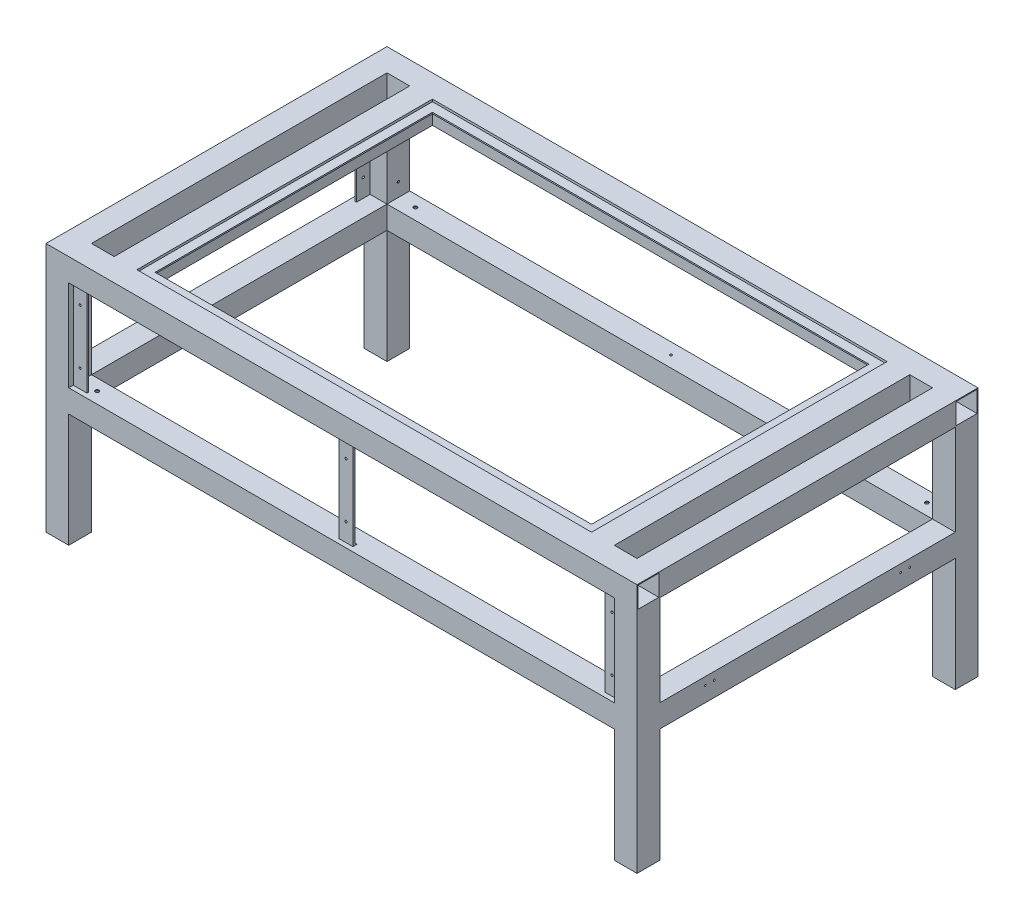
from build123d import *

# Parameters (mm, degrees)
ESQUISSE1_W                = 1300
ESQUISSE1_H                = 750
ESQUISSE1_W_2              = 1200
ESQUISSE1_H_2              = 650
BOSS_EXTRU_1_DEPTH         = 550
ESQUISSE2_W                = 1200
ESQUISSE2_H                = 200
ESQUISSE2_H_2              = 250
ENL_V_MAT_EXTRU_1_DEPTH    = 1599.436736315
ESQUISSE3_W                = 650
ESQUISSE3_H                = 200
ESQUISSE3_H_2              = 250
ENL_V_MAT_EXTRU_2_DEPTH    = 1599.436736315
ESQUISSE4_W                = 50
ESQUISSE4_H                = 650
BOSS_EXTRU_2_DEPTH         = 50
BOSS_EXTRU_2_2_DEPTH       = 50
ESQUISSE18_R               = 4
ENL_V_MAT_EXTRU_5_DEPTH    = 80
ESQUISSE19_R               = 15
ENL_V_MAT_EXTRU_6_DEPTH    = 48
ESQUISSE20_W               = 46
ESQUISSE20_H               = 46
ENL_V_MAT_EXTRU_7_DEPTH    = 10000
ESQUISSE21_W               = 46
ESQUISSE21_H               = 46
ENL_V_MAT_EXTRU_8_DEPTH    = 500
ESQUISSE22_W               = 30
ESQUISSE22_H               = 200
BOSS_EXTRU_11_DEPTH        = 3
ESQUISSE23_W               = 30
ESQUISSE23_H               = 200
ESQUISSE23_R               = 2.5
BOSS_EXTRU_12_DEPTH        = 3
ESQUISSE25_W               = 1000
ESQUISSE25_H               = 20
BOSS_EXTRU_14_DEPTH        = 3
ESQUISSE26_W               = 1000
ESQUISSE26_H               = 20
BOSS_EXTRU_15_DEPTH        = 3
ESQUISSE27_W               = 650
ESQUISSE27_H               = 20
BOSS_EXTRU_16_DEPTH        = 3
ESQUISSE28_W               = 20
ESQUISSE28_H               = 650
BOSS_EXTRU_17_DEPTH        = 3
ESQUISSE29_R               = 2.5
ENL_V_MAT_EXTRU_9_DEPTH    = 10
ESQUISSE30_R               = 2.5
ENL_V_MAT_EXTRU_10_DEPTH   = 15
ESQUISSE31_W               = 30
ESQUISSE31_H               = 5
BOSS_EXTRU_18_DEPTH        = 200
CONG_1_R                   = 5
ESQUISSE32_R               = 2.5
ENL_V_MAT_EXTRU_11_DEPTH   = 5
SYM_TRIE15_COPY_1_SKETCH_W = 30
SYM_TRIE15_COPY_1_SKETCH_H = 200
SYM_TRIE15_COPY_1_DEPTH    = 3
SYM_TRIE15_COPY_2_SKETCH_W = 30
SYM_TRIE15_COPY_2_SKETCH_H = 200
SYM_TRIE15_COPY_2_SKETCH_R = 2.5
SYM_TRIE15_COPY_2_DEPTH    = 3
SYM_TRIE15_COPY_3_SKETCH_W = 30
SYM_TRIE15_COPY_3_SKETCH_H = 200
SYM_TRIE15_COPY_3_DEPTH    = 3
SYM_TRIE15_COPY_4_SKETCH_W = 30
SYM_TRIE15_COPY_4_SKETCH_H = 200
SYM_TRIE15_COPY_4_SKETCH_R = 2.5
SYM_TRIE15_COPY_4_DEPTH    = 3
ESQUISSE33_W               = 80.648964208
ESQUISSE33_H               = 200
ENL_V_MAT_EXTRU_12_DEPTH   = 78
ESQUISSE34_R               = 2
ENL_V_MAT_EXTRU_13_DEPTH   = 25


with BuildPart() as part:
    # Esquisse1 → Boss.-Extru.1 (new body)
    with BuildSketch(Plane(origin=(0, 0, 0), x_dir=(1, 0, 0), z_dir=(0, 1, 0))):
        with Locations((650, 375)):
            Rectangle(ESQUISSE1_W, ESQUISSE1_H)
        with Locations((650, 375)):
            Rectangle(ESQUISSE1_W_2, ESQUISSE1_H_2, mode=Mode.SUBTRACT)
    extrude(amount=-BOSS_EXTRU_1_DEPTH)

    # Esquisse2 → Enlèv. mat.-Extru.1 (cut, through all)
    with BuildSketch(Plane.XY):
        with Locations((650, -150)):
            Rectangle(ESQUISSE2_W, ESQUISSE2_H)
        with Locations((650, -425)):
            Rectangle(ESQUISSE2_W, ESQUISSE2_H_2)
    extrude(amount=-ENL_V_MAT_EXTRU_1_DEPTH, mode=Mode.SUBTRACT)

    # Esquisse3 → Enlèv. mat.-Extru.2 (cut, through all)
    with BuildSketch(Plane.ZY):
        with Locations((-375, -150)):
            Rectangle(ESQUISSE3_W, ESQUISSE3_H)
        with Locations((-375, -425)):
            Rectangle(ESQUISSE3_W, ESQUISSE3_H_2)
    extrude(amount=-ENL_V_MAT_EXTRU_2_DEPTH, mode=Mode.SUBTRACT)

    # Esquisse18 → Enlèv. mat.-Extru.5 (cut)
    with BuildSketch(Plane(origin=(0, -250, 0), x_dir=(1, 0, 0), z_dir=(0, 1, 0))):
        with Locations((1212.5, 25)):
            Circle(ESQUISSE18_R)
        with Locations((87.5, 25)):
            Circle(ESQUISSE18_R)
        with Locations((87.5, 725)):
            Circle(ESQUISSE18_R)
        with Locations((1212.5, 725)):
            Circle(ESQUISSE18_R)
    extrude(amount=-ENL_V_MAT_EXTRU_5_DEPTH, mode=Mode.SUBTRACT)

    # Esquisse19 → Enlèv. mat.-Extru.6 (cut)
    with BuildSketch(Plane(origin=(0, -300, 0), x_dir=(-1, 0, 0), z_dir=(0, -1, 0))):
        with Locations((-1212.5, 725)):
            Circle(ESQUISSE19_R)
        with Locations((-87.5, 725)):
            Circle(ESQUISSE19_R)
        with Locations((-87.5, 25)):
            Circle(ESQUISSE19_R)
        with Locations((-1212.5, 25)):
            Circle(ESQUISSE19_R)
    extrude(amount=-ENL_V_MAT_EXTRU_6_DEPTH, mode=Mode.SUBTRACT)

    # Esquisse20 → Enlèv. mat.-Extru.7 (cut)
    with BuildSketch(Plane.ZY):
        with Locations((-25, -25)):
            Rectangle(ESQUISSE20_W, ESQUISSE20_H)
        with Locations((-725, -25)):
            Rectangle(ESQUISSE20_W, ESQUISSE20_H)
    extrude(amount=-ENL_V_MAT_EXTRU_7_DEPTH, mode=Mode.SUBTRACT)

    # Esquisse21 → Enlèv. mat.-Extru.8 (cut)
    with BuildSketch(Plane(origin=(0, -550, 0), x_dir=(-1, 0, 0), z_dir=(0, -1, 0))):
        with Locations((-1275, 25)):
            Rectangle(ESQUISSE21_W, ESQUISSE21_H)
        with Locations((-1275, 725)):
            Rectangle(ESQUISSE21_W, ESQUISSE21_H)
        with Locations((-25, 725)):
            Rectangle(ESQUISSE21_W, ESQUISSE21_H)
        with Locations((-25, 25)):
            Rectangle(ESQUISSE21_W, ESQUISSE21_H)
    extrude(amount=-ENL_V_MAT_EXTRU_8_DEPTH, mode=Mode.SUBTRACT)

    # Esquisse22 → Boss.-Extru.11 (add)
    with BuildSketch(Plane(origin=(0, 0, -50), x_dir=(-1, 0, 0), z_dir=(0, 0, -1))):
        with Locations((-25, -150)):
            Rectangle(ESQUISSE22_W, ESQUISSE22_H)
    boss_extru_11 = extrude(amount=BOSS_EXTRU_11_DEPTH)

    # Esquisse23 → Boss.-Extru.12 (add)
    with BuildSketch(Plane.ZY.offset(-10)):
        with Locations((-65, -150)):
            Rectangle(ESQUISSE23_W, ESQUISSE23_H)
        with Locations((-65, -90)):
            Circle(ESQUISSE23_R, mode=Mode.SUBTRACT)
        with Locations((-65, -210)):
            Circle(ESQUISSE23_R, mode=Mode.SUBTRACT)
    boss_extru_12 = extrude(amount=-BOSS_EXTRU_12_DEPTH)

    # Symétrie3: Boss.-Extru.11, Boss.-Extru.12 across plane
    add(boss_extru_11.mirror(Plane(origin=(0, 0, 0), x_dir=(-0.7071067811865475, 0, 0.7071067811865477), z_dir=(-0.7071067811865476, 0, -0.7071067811865475))))
    add(boss_extru_12.mirror(Plane(origin=(0, 0, 0), x_dir=(-0.7071067811865475, 0, 0.7071067811865477), z_dir=(-0.7071067811865476, 0, -0.7071067811865475))))



with BuildPart() as body_2:
    # Esquisse4 → Boss.-Extru.2 (new body)
    with BuildSketch(Plane(origin=(0, 0, 0), x_dir=(1, 0, 0), z_dir=(0, 1, 0))):
        with Locations((125, 375)):
            Rectangle(ESQUISSE4_W, ESQUISSE4_H)
    extrude(amount=-BOSS_EXTRU_2_DEPTH)


with BuildPart() as body_3:
    # Esquisse4 → Boss.-Extru.2 2 (new body)
    with BuildSketch(Plane(origin=(0, 0, 0), x_dir=(1, 0, 0), z_dir=(0, 1, 0))):
        with Locations((1175, 375)):
            Rectangle(ESQUISSE4_W, ESQUISSE4_H)
    extrude(amount=-BOSS_EXTRU_2_2_DEPTH)


with BuildPart() as part_1:
    add(part.part)

    add(body_2.part)  # Boss.-Extru.14 merges body 2

    add(body_3.part)  # Boss.-Extru.14 merges body 3
    # Esquisse25 → Boss.-Extru.14 (add)
    with BuildSketch(Plane(origin=(0, 0, -50), x_dir=(-1, 0, 0), z_dir=(0, 0, -1))):
        with Locations((-650, -15)):
            Rectangle(ESQUISSE25_W, ESQUISSE25_H)
    boss_extru_14 = extrude(amount=BOSS_EXTRU_14_DEPTH)

    # Esquisse26 → Boss.-Extru.15 (add)
    with BuildSketch(Plane(origin=(0, -5, 0), x_dir=(1, 0, 0), z_dir=(0, 1, 0))):
        with Locations((650, 60)):
            Rectangle(ESQUISSE26_W, ESQUISSE26_H)
    boss_extru_15 = extrude(amount=-BOSS_EXTRU_15_DEPTH)

    # Symétrie6: Boss.-Extru.14, Boss.-Extru.15 across plane
    add(boss_extru_14.mirror(Plane.XY.offset(-375)))
    add(boss_extru_15.mirror(Plane.XY.offset(-375)))

    # Esquisse27 → Boss.-Extru.16 (add)
    with BuildSketch(Plane.ZY.offset(-1150)):
        with Locations((-375, -15)):
            Rectangle(ESQUISSE27_W, ESQUISSE27_H)
    boss_extru_16 = extrude(amount=BOSS_EXTRU_16_DEPTH)

    # Esquisse28 → Boss.-Extru.17 (add)
    with BuildSketch(Plane(origin=(0, -5, 0), x_dir=(1, 0, 0), z_dir=(0, 1, 0))):
        with Locations((1140, 375)):
            Rectangle(ESQUISSE28_W, ESQUISSE28_H)
    boss_extru_17 = extrude(amount=-BOSS_EXTRU_17_DEPTH)

    # Symétrie7: Boss.-Extru.16, Boss.-Extru.17 across plane
    add(boss_extru_16.mirror(Plane.ZY.offset(-650)))
    add(boss_extru_17.mirror(Plane.ZY.offset(-650)))

    # Esquisse29 → Enlèv. mat.-Extru.9 (cut)
    with BuildSketch(Plane.ZY.offset(-1250)):
        with Locations((-725, -220)):
            Circle(ESQUISSE29_R)
        with Locations((-725, -80)):
            Circle(ESQUISSE29_R)
    enl_v_mat_extru_9 = extrude(amount=-ENL_V_MAT_EXTRU_9_DEPTH, mode=Mode.SUBTRACT)

    # Symétrie9: Enlèv. mat.-Extru.9 across plane
    add(enl_v_mat_extru_9.mirror(Plane.ZY.offset(-650)), mode=Mode.SUBTRACT)

    # Esquisse30 → Enlèv. mat.-Extru.10 (cut)
    with BuildSketch(Plane(origin=(0, -250, 0), x_dir=(1, 0, 0), z_dir=(0, 1, 0))):
        with Locations((650, 725)):
            Circle(ESQUISSE30_R)
    enl_v_mat_extru_10 = extrude(amount=-ENL_V_MAT_EXTRU_10_DEPTH, mode=Mode.SUBTRACT)

    # Symétrie10: Enlèv. mat.-Extru.10 across plane
    add(enl_v_mat_extru_10.mirror(Plane(origin=(0, -150, 0), x_dir=(0, 0, 1), z_dir=(0, -1, 0))), mode=Mode.SUBTRACT)

    # Esquisse31 → Boss.-Extru.18 (add)
    with BuildSketch(Plane(origin=(0, -250, 0), x_dir=(1, 0, 0), z_dir=(0, 1, 0))):
        with Locations((650, 12.5)):
            Rectangle(ESQUISSE31_W, ESQUISSE31_H)
    extrude(amount=BOSS_EXTRU_18_DEPTH)

    # Congé1
    cong_1_edges = [part_1.edges().sort_by_distance(p)[0] for p in [
        (650, -250, -15),
        (650, -50, -15),
    ]]
    fillet(cong_1_edges, radius=CONG_1_R)

    # Esquisse32 → Enlèv. mat.-Extru.11 (cut)
    with BuildSketch(Plane.XY.offset(-10)):
        with Locations((650, -210)):
            Circle(ESQUISSE32_R)
        with Locations((650, -90)):
            Circle(ESQUISSE32_R)
    extrude(amount=-ENL_V_MAT_EXTRU_11_DEPTH, mode=Mode.SUBTRACT)

    # Symétrie11: Boss.-Extru.12 across plane
    add(boss_extru_12.mirror(Plane.XY.offset(-375)))

    # Symétrie15 copy 1 sketch → Symétrie15 copy 1 (add)
    with BuildSketch(Plane.ZY.offset(-1250)):
        with Locations((-25, -150)):
            Rectangle(SYM_TRIE15_COPY_1_SKETCH_W, SYM_TRIE15_COPY_1_SKETCH_H)
    extrude(amount=SYM_TRIE15_COPY_1_DEPTH)

    # Symétrie15 copy 2 sketch → Symétrie15 copy 2 (add)
    with BuildSketch(Plane(origin=(1300, 0, -10), x_dir=(1, 0, 0), z_dir=(0, 0, 1))):
        with Locations((-65, -150)):
            Rectangle(SYM_TRIE15_COPY_2_SKETCH_W, SYM_TRIE15_COPY_2_SKETCH_H)
        with Locations((-65, -90)):
            Circle(SYM_TRIE15_COPY_2_SKETCH_R, mode=Mode.SUBTRACT)
        with Locations((-65, -210)):
            Circle(SYM_TRIE15_COPY_2_SKETCH_R, mode=Mode.SUBTRACT)
    extrude(amount=-SYM_TRIE15_COPY_2_DEPTH)

    # Symétrie15 copy 3 sketch → Symétrie15 copy 3 (add)
    with BuildSketch(Plane(origin=(1300, 0, -50), x_dir=(1, 0, 0), z_dir=(0, 0, -1))):
        with Locations((-25, 150)):
            Rectangle(SYM_TRIE15_COPY_3_SKETCH_W, SYM_TRIE15_COPY_3_SKETCH_H)
    extrude(amount=SYM_TRIE15_COPY_3_DEPTH)

    # Symétrie15 copy 4 sketch → Symétrie15 copy 4 (add)
    with BuildSketch(Plane(origin=(1290, 0, 0), x_dir=(0, 0, 1), z_dir=(1, 0, 0))):
        with Locations((-65, 150)):
            Rectangle(SYM_TRIE15_COPY_4_SKETCH_W, SYM_TRIE15_COPY_4_SKETCH_H)
        with Locations((-65, 90)):
            Circle(SYM_TRIE15_COPY_4_SKETCH_R, mode=Mode.SUBTRACT)
        with Locations((-65, 210)):
            Circle(SYM_TRIE15_COPY_4_SKETCH_R, mode=Mode.SUBTRACT)
    extrude(amount=-SYM_TRIE15_COPY_4_DEPTH)

    # Esquisse33 → Enlèv. mat.-Extru.12 (cut)
    with BuildSketch(Plane(origin=(1300, 0, 0), x_dir=(0, 0, -1), z_dir=(1, 0, 0))):
        with Locations((90.324482104, -150)):
            Rectangle(ESQUISSE33_W, ESQUISSE33_H)
    extrude(amount=-ENL_V_MAT_EXTRU_12_DEPTH, mode=Mode.SUBTRACT)

    # Esquisse34 → Enlèv. mat.-Extru.13 (cut)
    with BuildSketch(Plane(origin=(1300, 0, 0), x_dir=(0, 0, -1), z_dir=(1, 0, 0))):
        with Locations((150, -267)):
            Circle(ESQUISSE34_R)
        with Locations((170, -267)):
            Circle(ESQUISSE34_R)
    enl_v_mat_extru_13 = extrude(amount=-ENL_V_MAT_EXTRU_13_DEPTH, mode=Mode.SUBTRACT)

    # Symétrie16: Enlèv. mat.-Extru.13 across plane
    add(enl_v_mat_extru_13.mirror(Plane.XY.offset(-375)), mode=Mode.SUBTRACT)


solid = part_1.part
